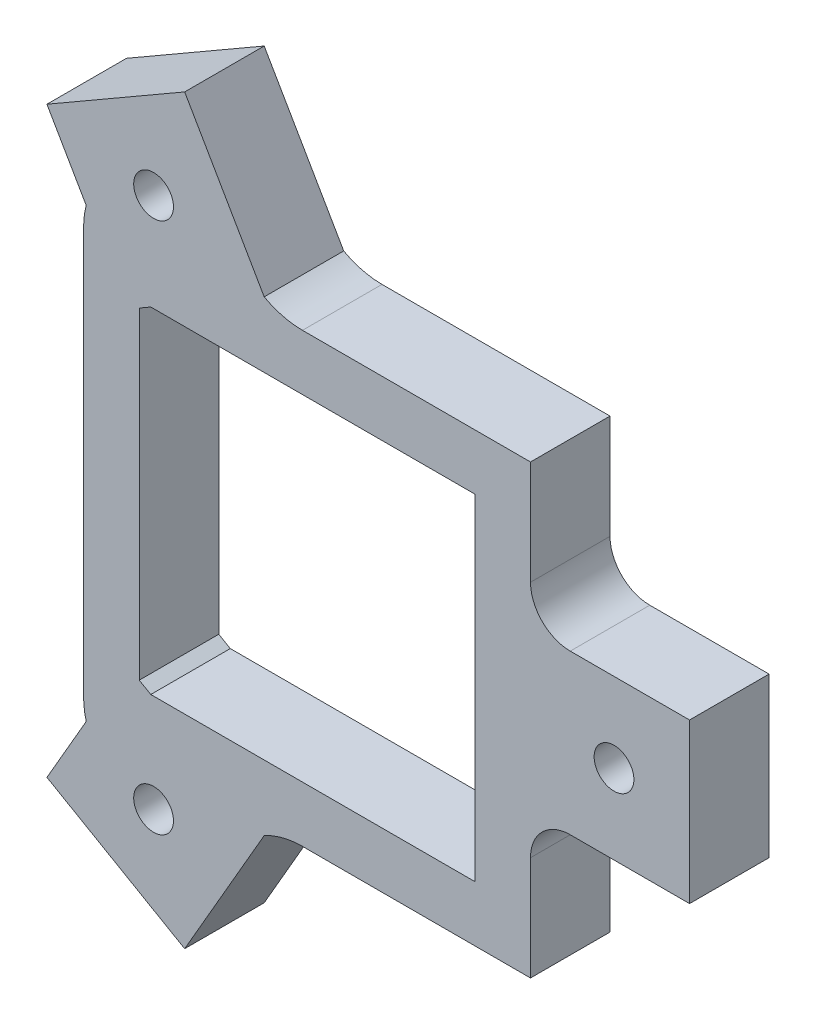
from build123d import *

# Parameters (mm, degrees)
SKIZZE2_W                       = 56.2
SKIZZE2_H                       = 56.2
SKIZZE2_W_2                     = 42.2
SKIZZE2_H_2                     = 42.2
AUFSATZ_LINEAR_AUSTRAGEN1_DEPTH = 10
SKIZZE3_W                       = 10
SKIZZE3_H                       = 20
AUFSATZ_LINEAR_AUSTRAGEN2_DEPTH = 20
SKIZZE4_R                       = 2.5
SCHNITT_LINEAR_AUSTRAGEN1_DEPTH = 27
KREISMUSTER1_COUNT              = 3
KREISMUSTER2_COUNT              = 3
VERRUNDUNG1_R                   = 10
VERRUNDUNG2_R                   = 10
VERRUNDUNG3_R                   = 10
VERRUNDUNG4_R                   = 5


with BuildPart() as part:
    # Skizze2 → Aufsatz-Linear austragen1 (new body)
    with BuildSketch(Plane.XY):
        with Locations((21.1, 21.1)):
            Rectangle(SKIZZE2_W, SKIZZE2_H)
        with Locations((21.1, 21.1)):
            Rectangle(SKIZZE2_W_2, SKIZZE2_H_2, mode=Mode.SUBTRACT)
    extrude(amount=AUFSATZ_LINEAR_AUSTRAGEN1_DEPTH)

    # Skizze3 → Aufsatz-Linear austragen2 (add)
    with BuildSketch(Plane(origin=(49.2, 0, 0), x_dir=(0, 0, -1), z_dir=(1, 0, 0))):
        with Locations((-5, 21.1)):
            Rectangle(SKIZZE3_W, SKIZZE3_H)
    aufsatz_linear_austragen2 = extrude(amount=AUFSATZ_LINEAR_AUSTRAGEN2_DEPTH)

    # Skizze4 → Schnitt-Linear austragen1 (cut)
    with BuildSketch(Plane.XY.offset(10)):
        with Locations((59.7, 21.1)):
            Circle(SKIZZE4_R)
    schnitt_linear_austragen1 = extrude(amount=-SCHNITT_LINEAR_AUSTRAGEN1_DEPTH, mode=Mode.SUBTRACT)

    # Kreismuster1: Aufsatz-Linear austragen2 ×3 about axis
    kreismuster1_axis = Axis((21.1, 21.1, 0), (0, 0, 1))
    for i in range(1, KREISMUSTER1_COUNT):
        add(aufsatz_linear_austragen2.rotate(kreismuster1_axis, i * 360 / KREISMUSTER1_COUNT))

    # Kreismuster2: Schnitt-Linear austragen1 ×3 about axis
    kreismuster2_axis = Axis((21.1, 21.1, 0), (0, 0, 1))
    for i in range(1, KREISMUSTER2_COUNT):
        add(schnitt_linear_austragen1.rotate(kreismuster2_axis, i * 360 / KREISMUSTER2_COUNT), mode=Mode.SUBTRACT)

    # Verrundung1
    # the kernel refuses this fillet: 10 mm, written as the material it adds along each edge
    with BuildSketch(Plane(origin=(13.570627693, 49.2, 10), x_dir=(0.866025403783509, 0.5000000000016102, 0), z_dir=(0, 0, -1))) as verrundung1_piece_1:
        with BuildLine():
            CenterArc((11.022527997, -5.183145878), VERRUNDUNG1_R, 120, 28.780734866)
            Line((6.022527997, 3.47710816), (0, 0))
            Line((0, 0), (2.470627693, 0))
        make_face()
    extrude(amount=10)

    # Verrundung2
    # the kernel refuses this fillet: 10 mm, written as the material it takes off along each edge
    with BuildSketch(Plane(origin=(-7, 49.2, -6.36420772), x_dir=(0, -1, 0), z_dir=(0, 0, 1))) as verrundung2_piece_1:
        with BuildLine():
            CenterArc((2.545683088, 10), VERRUNDUNG2_R, 255.251993066, 14.748006934)
            Line((0, 0.329452052), (-0.050913662, 0.136041093))
            ThreePointArc((-0.050913662, 0.136041093), (-0.2, 0.164726026), (-0.2, 0))
            Line((-0.2, 0), (0, -0.2))
            Line((0, -0.2), (2.545683088, -0.2))
            Line((2.545683088, -0.2), (2.545683088, 0))
        make_face()
    extrude(amount=22.72841544, mode=Mode.SUBTRACT)

    # Verrundung3
    # the kernel refuses this fillet: 10 mm, written as the material it adds along each edge
    with BuildSketch(Plane(origin=(13.570627693, -7, 0), x_dir=(1, 0, 0), z_dir=(0, 0, 1))) as verrundung3_piece_1:
        with BuildLine():
            CenterArc((6.95421632, -10), VERRUNDUNG3_R, 90, 28.780734866)
            Line((2.139626345, -1.235313846), (0, 0))
            Line((0, 0), (6.95421632, 0))
        make_face()
    extrude(amount=10)
    # the kernel refuses this fillet: 10 mm, written as the material it takes off along each edge
    with BuildSketch(Plane(origin=(-7, -7, -6.36420772), x_dir=(1, 0, 0), z_dir=(0, 0, 1))) as verrundung3_2_piece_1:
        with BuildLine():
            CenterArc((10, 2.545683088), VERRUNDUNG3_R, 180, 14.748006934)
            Line((0, 2.545683088), (0, 0))
            Line((0, 0), (0.329452052, 0))
        make_face()
    extrude(amount=22.72841544, mode=Mode.SUBTRACT)

    # Verrundung4
    verrundung4_edges = [part.edges().sort_by_distance(p)[0] for p in [
        (49.2, 11.1, 5),
        (49.2, 31.1, 5),
    ]]
    fillet(verrundung4_edges, radius=VERRUNDUNG4_R)


solid = part.part
